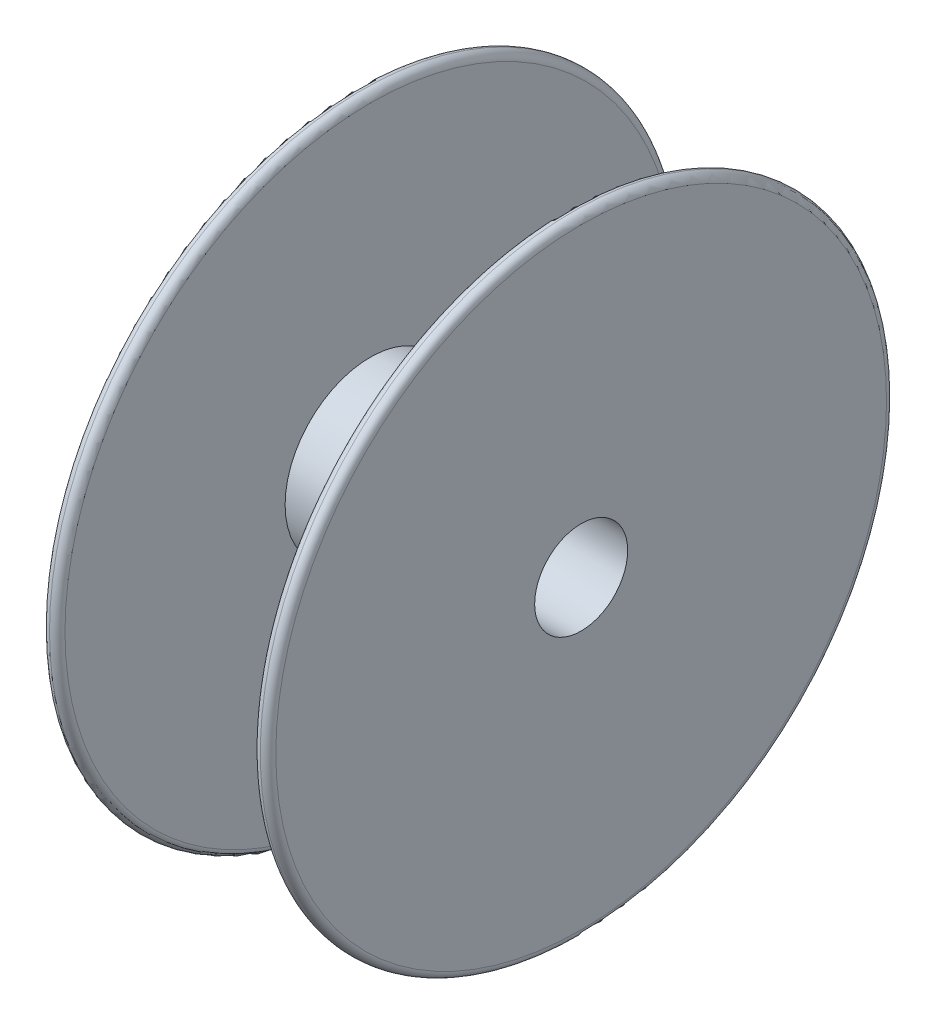
from build123d import *

# Parameters (mm, degrees)
SKETCH1_R           = 27.5
SKETCH1_R_2         = 15
BOSS_EXTRUDE1_DEPTH = 63
SKETCH2_R           = 101
SKETCH2_R_2         = 15
BOSS_EXTRUDE2_DEPTH = 5
BOSS_EXTRUDE3_START = 5
SKETCH3_R           = 101
SKETCH3_R_2         = 15
BOSS_EXTRUDE3_DEPTH = 5
FILLET1_R           = 2.5


with BuildPart() as part:
    # Sketch1 → Boss-Extrude1 (new body)
    with BuildSketch(Plane(origin=(0, 0, 0), x_dir=(0, 0, -1), z_dir=(1, 0, 0))):
        Circle(SKETCH1_R)
        Circle(SKETCH1_R_2, mode=Mode.SUBTRACT)
    extrude(amount=BOSS_EXTRUDE1_DEPTH)

    # Sketch2 → Boss-Extrude2 (add)
    with BuildSketch(Plane(origin=(63, 0, 0), x_dir=(0, 0, -1), z_dir=(1, 0, 0))):
        Circle(SKETCH2_R)
        Circle(SKETCH2_R_2, mode=Mode.SUBTRACT)
    extrude(amount=BOSS_EXTRUDE2_DEPTH)

    # Sketch3 → Boss-Extrude3 (add)
    with BuildSketch(Plane.ZY.offset(BOSS_EXTRUDE3_START)):
        with Locations(Location((0, 0, 0), (0, 0, 180))):
            Circle(SKETCH3_R)
        Circle(SKETCH3_R_2, mode=Mode.SUBTRACT)
    extrude(amount=-BOSS_EXTRUDE3_DEPTH)

    # Fillet1
    fillet1_edges = [part.edges().sort_by_distance(p)[0] for p in [
        (63, 0, 101),
        (-5, 0, 101),
        (0, 0, 101),
        (68, 0, 101),
    ]]
    fillet(fillet1_edges, radius=FILLET1_R - 0.0001)  # a hair under: the kernel refuses the full size


solid = part.part
